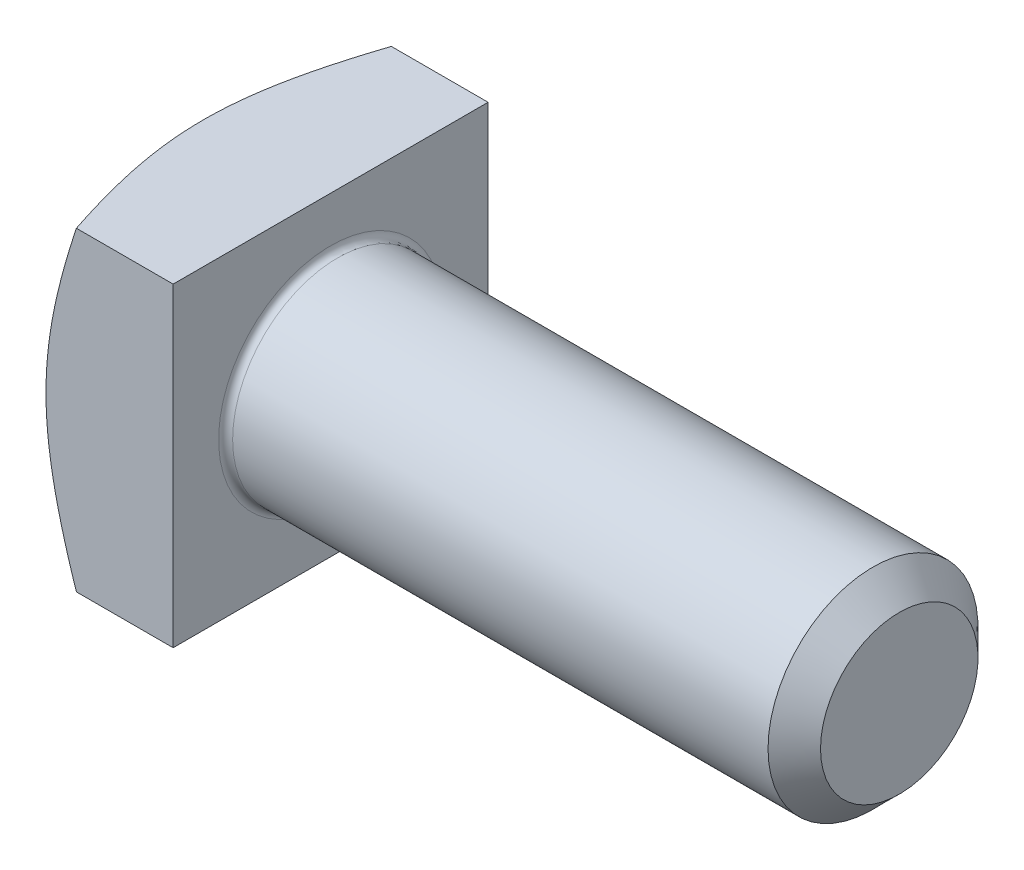
from build123d import *

# Parameters (mm, degrees)
BASEHEADSKE_W  = 36
BASEHEADSKE_H  = 36
BASEHEAD_DEPTH = 15
BODYSKE_W      = 80
BODYSKE_H      = 12
FILLET_2_R     = 0.8


with BuildPart() as part:
    # BaseHeadSke → BaseHead (new body)
    with BuildSketch(Plane(origin=(0, 0, 0), x_dir=(0, 0, -1), z_dir=(1, 0, 0))):
        Rectangle(BASEHEADSKE_W, BASEHEADSKE_H)
    extrude(amount=BASEHEAD_DEPTH)

    # BodySke → BaseBody (revolve)
    with BuildSketch(Plane.XY):
        with Locations((40, 6)):
            Rectangle(BODYSKE_W, BODYSKE_H)
    revolve(axis=Axis((0, 0, 0), (1, 0, 0)))

    # ChamferEndSke → ChamferEnd (revolve, cut)
    with BuildSketch(Plane(origin=(0, 0, 0), x_dir=(1, 0, 0), z_dir=(0, 1, 0))):
        Polygon((77, -12), (80, -9), (80, -12), align=None)
    revolve(axis=Axis((0, 0, 0), (1, 0, 0)), mode=Mode.SUBTRACT)

    # HeadChamferSke → HeadChamfer (revolve, cut)
    with BuildSketch(Plane.XY):
        Polygon((15, 49.167603808), (0, 49.167603808), (0, 17), align=None)
    revolve(axis=Axis((0, 0, 0), (1, 0, 0)), mode=Mode.SUBTRACT)

    # Fillet 2
    fillet_2_edges = [part.edges().sort_by_distance(p)[0] for p in [
        (15, -12, 0),
    ]]
    fillet(fillet_2_edges, radius=FILLET_2_R)


solid = part.part
